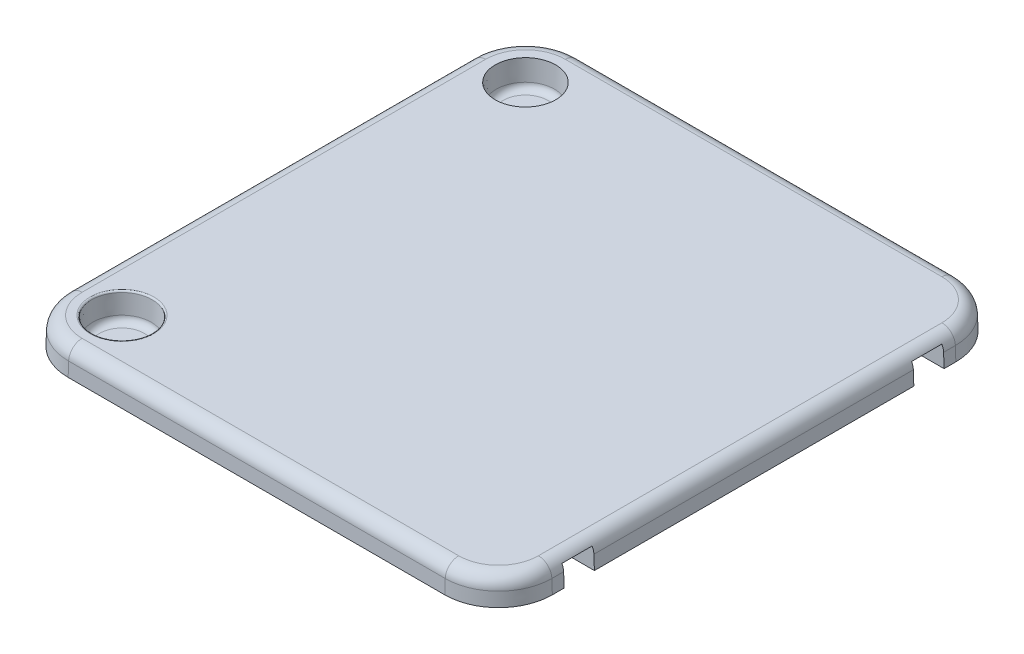
from build123d import *

# Parameters (mm, degrees)
EXTRUDE1_DEPTH          = 25.4
DRAFT1_ANGLE            = -2
FILLET1_R               = 12.7
SHELL2_T                = -3.175
RIB1_REACH              = 335.36
SKETCH3_WALLS_W         = 1109.591591228
SKETCH3_WALLS_H         = 3.175
SKETCH3_WALLS_W_2       = 1112.768526531
CUT_EXTRUDE2_DEPTH      = 334.359880758
CUT_EXTRUDE2_DEPTH_BACK = 334.359880758
SKETCH4_W               = 28.575
SKETCH4_H               = 19.05
CUT_EXTRUDE3_REACH      = 360.76
CUT_EXTRUDE3_START      = -25.4
SKETCH6_R               = 3.175
SKETCH7_R               = 28.575
EXTRUDE2_DEPTH          = 25.4
EXTRUDE2_DRAFT          = -3
FILLET2_R               = 6.35
RIB4_REACH              = 334.936
SKETCH9_WALLS_W         = 3.175
SKETCH9_WALLS_H         = 696.447518122
RIB4_DRAFT_ANGLE        = 2
FILLET3_R               = 1.5875


# Read off the part's stored shape, not the designer's step: Indent1
with BuildPart() as part:
    # Sketch1 → Extrude1 (new body)
    with BuildSketch(Plane(origin=(0, 0, 0), x_dir=(1, 0, 0), z_dir=(0, 1, 0))):
        with BuildLine():
            Line((228.6, 0), (228.6, 190.5))
            ThreePointArc((228.6, 190.5), (213.721024484, 226.421024484), (177.8, 241.3))
            Line((177.8, 241.3), (-177.8, 241.3))
            ThreePointArc((-177.8, 241.3), (-213.721024484, 226.421024484), (-228.6, 190.5))
            Line((-228.6, 190.5), (-228.6, 0))
            Line((-228.6, 0), (228.6, 0))
        make_face()
    extrude(amount=EXTRUDE1_DEPTH)

    # Draft1
    draft1_faces = [part.faces().sort_by_distance(p)[0] for p in [
        (228.6, 12.7, -95.25),
    ]]
    draft(draft1_faces, Plane(origin=(-177.8, 0, -190.5), x_dir=(0, 0, -1), z_dir=(0, -1, 0)), DRAFT1_ANGLE)

    # Fillet1
    fillet1_edges = [part.edges().sort_by_distance(p)[0] for p in [
        (227.713012455, 25.4, -95.25),
        (213.093829576, 25.4, -225.793829576),
        (0, 25.4, -240.413012455),
        (-213.093829576, 25.4, -225.793829576),
        (-227.713012455, 25.4, -95.25),
    ]]
    fillet(fillet1_edges, radius=FILLET1_R)

    # Shell2
    shell2_openings = [part.faces().sort_by_distance(p)[0] for p in [
        (0, 12.636517927, 0),
        (0, 0, -119.541485653),
    ]]
    offset(amount=SHELL2_T, openings=shell2_openings, kind=Kind.INTERSECTION)

    # Sketch3 walls → Rib1 (add, up to next)
    with BuildSketch(Plane.XZ, mode=Mode.PRIVATE) as rib1_sk1:
        with Locations((-4.987149841, -149.225)):
            Rectangle(SKETCH3_WALLS_W, SKETCH3_WALLS_H)
    rib1_tool1 = extrude(rib1_sk1.sketch, amount=-RIB1_REACH, mode=Mode.PRIVATE) - part.part
    # Sketch3 walls → Rib1 (add, up to next)
    with BuildSketch(Plane.XZ, mode=Mode.PRIVATE) as rib1_sk2:
        with Locations((-6.575617492, -180.975)):
            Rectangle(SKETCH3_WALLS_W_2, SKETCH3_WALLS_H)
    rib1_tool2 = extrude(rib1_sk2.sketch, amount=-RIB1_REACH, mode=Mode.PRIVATE) - part.part
    add(rib1_tool1.solids().sort_by_distance((-4.987149841, 0, -149.225))[0])
    add(rib1_tool2.solids().sort_by_distance((-6.575617493, 0, -180.975))[0])

    # Sketch4 → Cut-Extrude2 (cut, two sides: drawn at the far end of the back side and taken through both)
    with BuildSketch(Plane(origin=(0, 0, 0), x_dir=(0, 0, -1), z_dir=(1, 0, 0)).offset(-CUT_EXTRUDE2_DEPTH_BACK)):
        with Locations((165.1, 9.525)):
            Rectangle(SKETCH4_W, SKETCH4_H)
    extrude(amount=CUT_EXTRUDE2_DEPTH + CUT_EXTRUDE2_DEPTH_BACK, mode=Mode.SUBTRACT)

    # Sketch6 → Cut-Extrude3 (cut, up to next)
    with BuildSketch(Plane.XY.offset(CUT_EXTRUDE3_START), mode=Mode.PRIVATE) as cut_extrude3_sk1:
        with Locations((209.156785394, 6.35)):
            Circle(SKETCH6_R)
    cut_extrude3_tool1 = extrude(cut_extrude3_sk1.sketch, amount=-CUT_EXTRUDE3_REACH, mode=Mode.PRIVATE) & part.part
    # Sketch6 → Cut-Extrude3 (cut, up to next)
    with BuildSketch(Plane.XY.offset(CUT_EXTRUDE3_START), mode=Mode.PRIVATE) as cut_extrude3_sk2:
        with Locations((31.356785394, 6.35)):
            Circle(SKETCH6_R)
    cut_extrude3_tool2 = extrude(cut_extrude3_sk2.sketch, amount=-CUT_EXTRUDE3_REACH, mode=Mode.PRIVATE) & part.part
    add(cut_extrude3_tool1.solids().sort_by_distance((209.156785, 6.35, -25.4))[0], mode=Mode.SUBTRACT)
    add(cut_extrude3_tool1.solids().sort_by_distance((209.156785, 6.35, -25.4))[1], mode=Mode.SUBTRACT)
    add(cut_extrude3_tool2.solids().sort_by_distance((31.356785, 6.35, -25.4))[0], mode=Mode.SUBTRACT)
    add(cut_extrude3_tool2.solids().sort_by_distance((31.356785, 6.35, -25.4))[1], mode=Mode.SUBTRACT)

    # Sketch9 walls → Rib4 (add, up to next)
    with BuildSketch(Plane.XZ.offset(-19.05), mode=Mode.PRIVATE) as rib4_sk1:
        with Locations((63.5, -165.1)):
            Rectangle(SKETCH9_WALLS_W, SKETCH9_WALLS_H)
    rib4_tool1 = extrude(rib4_sk1.sketch, amount=-RIB4_REACH, mode=Mode.PRIVATE) - part.part
    # Sketch9 walls → Rib4 (add, up to next)
    with BuildSketch(Plane.XZ.offset(-19.05), mode=Mode.PRIVATE) as rib4_sk2:
        with Locations((-63.5, -165.1)):
            Rectangle(SKETCH9_WALLS_W, SKETCH9_WALLS_H)
    rib4_tool2 = extrude(rib4_sk2.sketch, amount=-RIB4_REACH, mode=Mode.PRIVATE) - part.part
    add(rib4_tool1.solids().sort_by_distance((63.5, 19.05, -165.1))[0])
    add(rib4_tool2.solids().sort_by_distance((-63.5, 19.05, -165.1))[0])

    # Rib4 draft
    rib4_draft_faces = [part.faces().sort_by_distance(p)[0] for p in [
        (61.9125, 19.55, -165.1),
        (65.0875, 19.55, -165.1),
        (-65.0875, 19.55, -165.1),
        (-61.9125, 19.55, -165.1),
    ]]
    draft(rib4_draft_faces, Plane(origin=(63.5, 19.05, -165.1), x_dir=(1, 0, 0), z_dir=(0, -1, 0)), RIB4_DRAFT_ANGLE)

    # Indent1 outline → Indent1 (revolve, cut)
    with BuildSketch(Plane(origin=(-177.8, 0, -190.5), x_dir=(1, 0, 0), z_dir=(0, 0, 1))):
        with BuildLine():
            Line((27.559214953, 6.017666678), (28.575, 25.4))
            Line((28.575, 25.4), (0, 25.4))
            Line((0, 25.4), (0, 0))
            Line((0, 0), (21.217917408, 0))
            ThreePointArc((21.217917408, 0), (25.588968963, 1.743872744), (27.559214953, 6.017666678))
        make_face()
    revolve(axis=Axis((-177.8, 0, -190.5), (0, 1, 0)), mode=Mode.SUBTRACT)

    # Indent1 2 outline → Indent1 2 (revolve)
    with BuildSketch(Plane(origin=(-177.8, 0, -190.5), x_dir=(1, 0, 0), z_dir=(0, 0, 1))):
        with BuildLine():
            Line((30.729863726, 5.851500013), (31.587962499, 22.225))
            Line((31.587962499, 22.225), (31.587962499, 25.4))
            Line((31.587962499, 25.4), (28.575, 25.4))
            Line((28.575, 25.4), (27.559214953, 6.017666678))
            ThreePointArc((27.559214953, 6.017666678), (25.588968963, 1.743872744), (21.217917408, 0))
            Line((21.217917408, 0), (0, 0))
            Line((0, 0), (0, -3.175))
            Line((0, -3.175), (21.217917408, -3.175))
            ThreePointArc((21.217917408, -3.175), (27.77449474, -0.559190885), (30.729863726, 5.851500013))
        make_face()
    revolve(axis=Axis((-177.8, 0, -190.5), (0, 1, 0)))

    # Mirror1: part across plane


with BuildPart() as body_2:
    # Sketch7 → Extrude2 (with draft: the straight prism first)
    with BuildSketch(Plane(origin=(0, 25.4, 0), x_dir=(-1, 0, 0), z_dir=(0, 1, 0))):
        with Locations((177.8, -190.5)):
            Circle(SKETCH7_R)
    extrude(amount=-EXTRUDE2_DEPTH)
    # Extrude2: the draft: its side faces are tilted about the plane it starts from
    extrude2_sides = [body_2.faces().sort_by_distance(p)[0] for p in [
        (-149.225, 12.7, -190.5),
    ]]
    draft(extrude2_sides, Plane(origin=(0, 25.4, 0), x_dir=(-1, 0, 0), z_dir=(0, 1, 0)), EXTRUDE2_DRAFT)

    # Fillet2
    fillet2_edges = [body_2.edges().sort_by_distance(p)[0] for p in [
        (-150.556157594, 0, -190.5),
    ]]
    fillet(fillet2_edges, radius=FILLET2_R)


with BuildPart() as part_1:
    add(part.part)
    add(part.part.mirror(Plane(origin=(-228.6, 25.4, 0), x_dir=(1, 0, 0), z_dir=(0, 0, -1))))

    # Fillet3
    fillet3_edges = [part_1.edges().sort_by_distance(p)[0] for p in [
        (-206.375, 25.4, 190.5),
    ]]
    fillet(fillet3_edges, radius=FILLET3_R)


solid = part_1.part
